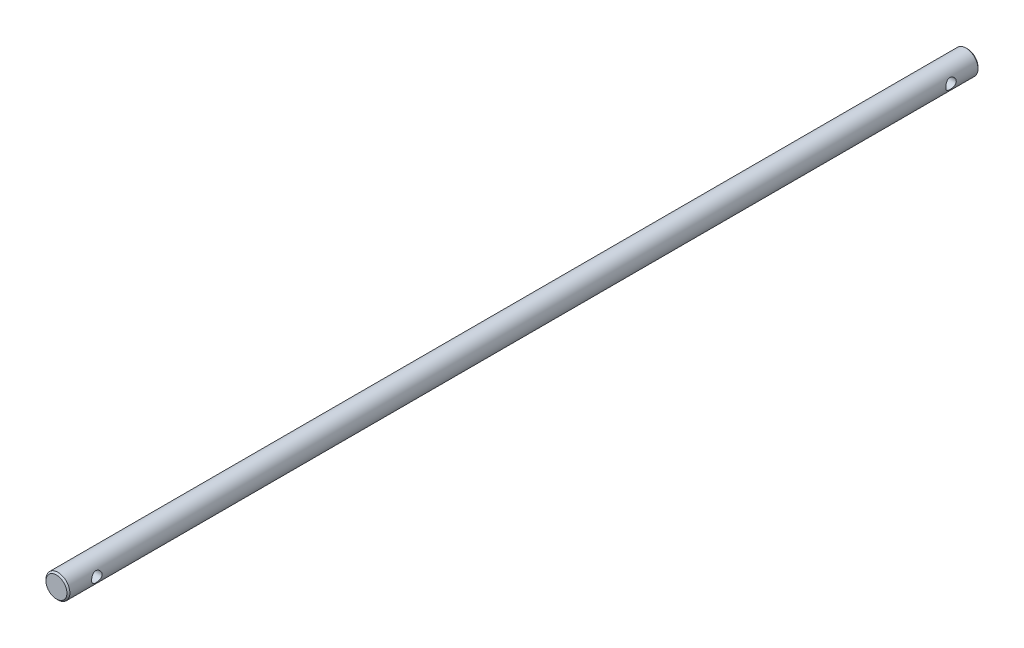
from build123d import *

# Parameters (mm, degrees)
SKETCH1_R           = 4
BOSS_EXTRUDE1_DEPTH = 304.8
CHAMFER1_SIZE       = 0.5
SKETCH3_R           = 1.7526
CUT_EXTRUDE1_DEPTH  = 305.931205356


with BuildPart() as part:
    # Sketch1 → Boss-Extrude1 (new body)
    with BuildSketch(Plane.XY):
        Circle(SKETCH1_R)
    extrude(amount=BOSS_EXTRUDE1_DEPTH)

    # Chamfer1
    chamfer1_edges = [part.edges().sort_by_distance(p)[0] for p in [
        (-4, 0, 0),
        (-4, 0, 304.8),
    ]]
    chamfer(chamfer1_edges, length=CHAMFER1_SIZE)

    # Sketch3 → Cut-Extrude1 (cut, through all)
    with BuildSketch(Plane.ZY.offset(4)):
        with Locations((9.525, 0)):
            Circle(SKETCH3_R)
        with Locations((295.275, 0)):
            Circle(SKETCH3_R)
    extrude(amount=-CUT_EXTRUDE1_DEPTH, mode=Mode.SUBTRACT)


solid = part.part
